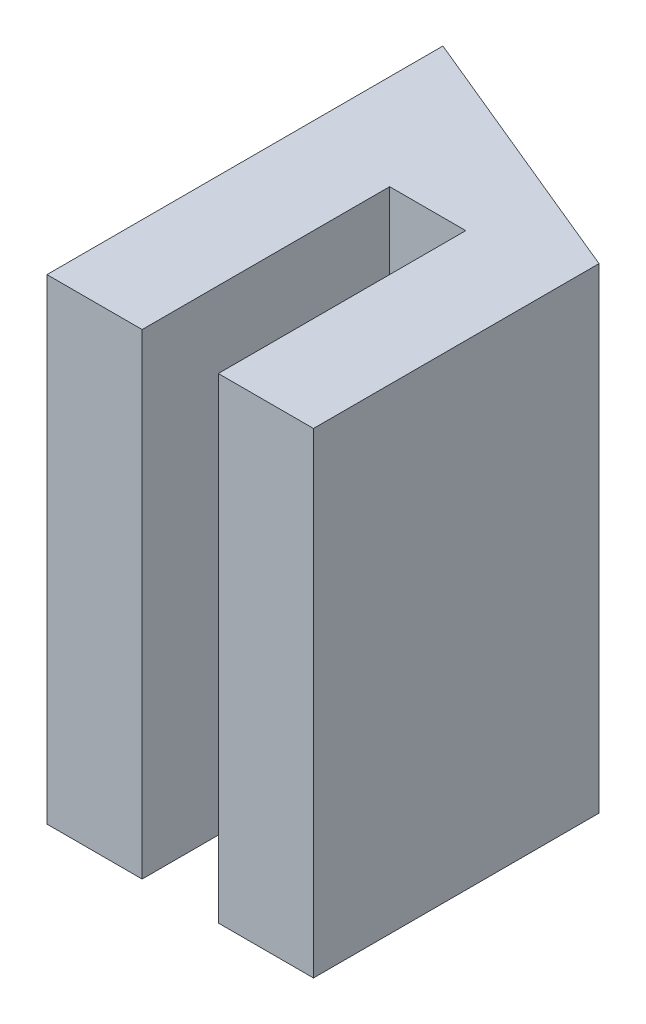
from build123d import *

# Parameters (mm, degrees)
BOSS_EXTRUDE1_DEPTH = 25


with BuildPart() as part:
    # Sketch2 → Boss-Extrude1 (new body)
    with BuildSketch(Plane(origin=(0, 0, 0), x_dir=(1, 0, 0), z_dir=(0, 1, 0))):
        Polygon((0, 0), (0, -15), (-5, -15), (-5, -2), (-9, -2), (-9, -15), (-14, -15), (-14, 5.798989873), align=None)
    extrude(amount=BOSS_EXTRUDE1_DEPTH)


solid = part.part
